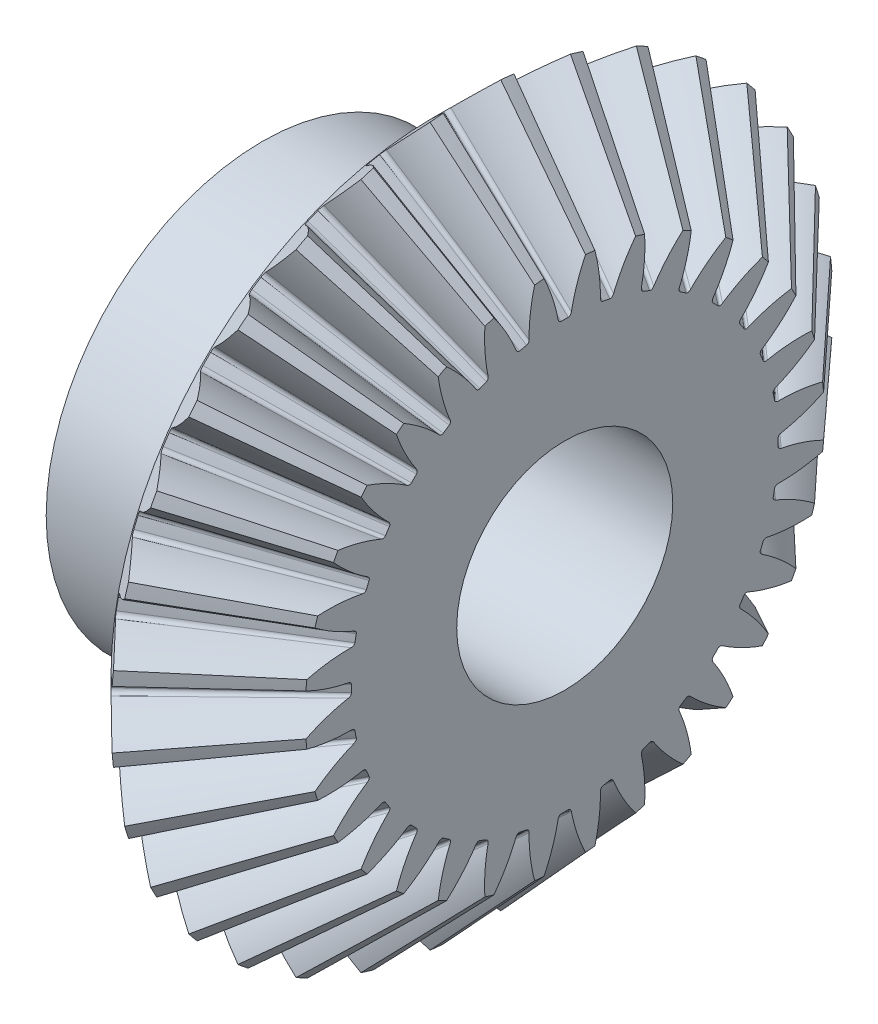
from build123d import *

# Parameters (mm, degrees)
TEETHCUTS_COUNT         = 32
TEETHCUTS_ANGLE         = 348.75
HUBSKE_R                = 15.875
HUB_DEPTH               = 12.575740277
BORSKE_R                = 7.9375
BORE_DEPTH              = 39.6875508
CUT_EXTRUDE1_DEPTH      = 40.446942381
CUT_EXTRUDE1_DEPTH_BACK = 40.446942381
SKETCH1_W               = 6.35
SKETCH1_H               = 50.8
BOSS_EXTRUDE1_START     = 0.063769234
SKETCH2_R               = 15.376886158
SKETCH2_R_2             = 7.9375
BOSS_EXTRUDE1_DEPTH     = 0.063769234


with BuildPart() as part:
    # BasProSke → Base-Revolve (revolve)
    with BuildSketch(Plane(origin=(0, 0, 0), x_dir=(1, 0, 0), z_dir=(0, 1, 0)), mode=Mode.PRIVATE) as base_revolve_sk:
        Polygon((0, 0), (0, 23.688138678), (2.834393341, 26.522532014), (11.417774453, 17.145400885), (9.585490489, 15.313116924), (9.585490489, 0), align=None)
    revolve(base_revolve_sk.sketch.rotate(Axis((-10, 0, 0), (1, 0, 0)), 180), axis=Axis((-10, 0, 0), (1, 0, 0)))

    # ToothCut: read off the stored shape, not the designer's step
    # ToothCut: loft between two sections, ruled curve by curve
    toothcut_from = [
        Edge.make_bspline([(27.118304418, 0.006443093, -0.00884661), (27.113940973, 0.002079649, -0.015202531), (27.107707583, -0.004153741, -0.014326907), (27.104313514, -0.007547811, -0.006881264)], [0, 0, 0, 0, 1, 1, 1, 1], 3, [1, 0.74816988, 0.74816988, 1]),
        Edge.make_bspline([(27.104313514, -0.007547811, 0.006881264), (27.107707583, -0.004153741, 0.014326907), (27.113940973, 0.002079649, 0.015202531), (27.118304418, 0.006443093, 0.00884661)], [0, 0, 0, 0, 1, 1, 1, 1], 3, [1, 0.74816988, 0.74816988, 1]),
        Edge.make_bspline([(27.104313514, -0.007547811, -0.006881264), (27.103825837, -0.008035487, -0.005811438), (27.1034565, -0.008404825, -0.004650677), (27.103213772, -0.008647553, -0.003424973)], [0, 0, 0, 0, 1, 1, 1, 1], 3, [1, 0.992536385, 0.992536385, 1]),
        Edge.make_bspline([(27.103213772, -0.008647553, 0.003424973), (27.1034565, -0.008404825, 0.004650677), (27.103825837, -0.008035487, 0.005811438), (27.104313514, -0.007547811, 0.006881264)], [0, 0, 0, 0, 1, 1, 1, 1], 3, [1, 0.992536385, 0.992536385, 1]),
        Edge.make_bspline([(27.103213772, -0.008647553, -0.003424973), (27.102767328, -0.009093996, -0.001170571), (27.102767328, -0.009093996, 0.001170571), (27.103213772, -0.008647553, 0.003424973)], [0, 0, 0, 0, 1, 1, 1, 1], 3, [1, 0.975299455, 0.975299455, 1]),
        Edge.make_line((27.118304418, 0.006443093, 0.00884661), (27.118304418, 0.006443093, -0.00884661)),
    ]
    toothcut_to = [
        Edge.make_bspline([(3.138104754, 26.826243427, -2.461077354), (2.356718233, 26.044856908, -1.643024609), (1.475325857, 25.163464533, -1.062822021), (0.529631602, 24.217770279, -0.743972788)], [0, 0, 0, 0, 1, 1, 1, 1], 3, [1, 0.986497132, 0.986497132, 1]),
        Edge.make_bspline([(0.529631602, 24.217770279, 0.743972788), (1.475325857, 25.163464533, 1.062822021), (2.356718233, 26.044856908, 1.643024609), (3.138104754, 26.826243427, 2.461077354)], [0, 0, 0, 0, 1, 1, 1, 1], 3, [1, 0.986497132, 0.986497132, 1]),
        Edge.make_bspline([(0.529631602, 24.217770279, -0.743972788), (0.412037997, 24.100176675, -0.704325057), (0.337929184, 24.026067862, -0.569253885), (0.339981417, 24.028120095, -0.398315209)], [0, 0, 0, 0, 1, 1, 1, 1], 3, [1, 0.853025782, 0.853025782, 1]),
        Edge.make_bspline([(0.339981417, 24.028120095, 0.398315209), (0.337929184, 24.026067862, 0.569253885), (0.412037997, 24.100176675, 0.704325057), (0.529631602, 24.217770279, 0.743972788)], [0, 0, 0, 0, 1, 1, 1, 1], 3, [1, 0.853025782, 0.853025782, 1]),
        Edge.make_bspline([(0.339981417, 24.028120095, -0.398315209), (0.343169291, 24.031307969, -0.132784493), (0.343169291, 24.031307969, 0.132784493), (0.339981417, 24.028120095, 0.398315209)], [0, 0, 0, 0, 1, 1, 1, 1], 3, [1, 0.99990393, 0.99990393, 1]),
        Edge.make_line((3.138104754, 26.826243427, 2.461077354), (3.138104754, 26.826243427, -2.461077354)),
    ]
    toothcut = Solid(Shell([*[Face.make_surface_from_curves(toothcut_from[k], toothcut_to[k]) for k in range(6)], Face(Wire(toothcut_from)), Face(Wire(toothcut_to))]))
    add(toothcut, mode=Mode.SUBTRACT)

    # TeethCuts: ToothCut ×32 about axis
    teethcuts_axis = Axis((-10, 0, 0), (1, 0, 0))
    for i in range(1, TEETHCUTS_COUNT):
        add(toothcut.rotate(teethcuts_axis, i * TEETHCUTS_ANGLE / (TEETHCUTS_COUNT - 1)), mode=Mode.SUBTRACT)

    # HubSke → Hub (add)
    with BuildSketch(Plane.ZY):
        with Locations(Location((0, 0, 0), (0, 0, 180))):
            Circle(HUBSKE_R)
    extrude(amount=HUB_DEPTH)

    # BorSke → Bore (cut, symmetric)
    with BuildSketch(Plane(origin=(0, 0, 0), x_dir=(0, 0, -1), z_dir=(1, 0, 0))):
        with Locations(Location((0, 0, 0), (0, 0, 180))):
            Circle(BORSKE_R)
    extrude(amount=BORE_DEPTH, both=True, mode=Mode.SUBTRACT)

    # Sketch1 → Cut-Extrude1 (cut, two sides: drawn at the far end of the back side and taken through both)
    with BuildSketch(Plane.XY.offset(-CUT_EXTRUDE1_DEPTH_BACK)):
        with Locations((12.824259723, 0)):
            Rectangle(SKETCH1_W, SKETCH1_H)
    extrude(amount=CUT_EXTRUDE1_DEPTH + CUT_EXTRUDE1_DEPTH_BACK, mode=Mode.SUBTRACT)

    # Sketch2 → Boss-Extrude1 (add)
    with BuildSketch(Plane(origin=(9.585490489, 0, 0), x_dir=(0, 0, -1), z_dir=(1, 0, 0)).offset(BOSS_EXTRUDE1_START)):
        Circle(SKETCH2_R)
        with Locations(Location((0, 0, 0), (0, 0, 180))):
            Circle(SKETCH2_R_2, mode=Mode.SUBTRACT)
    extrude(amount=-BOSS_EXTRUDE1_DEPTH)


solid = part.part
